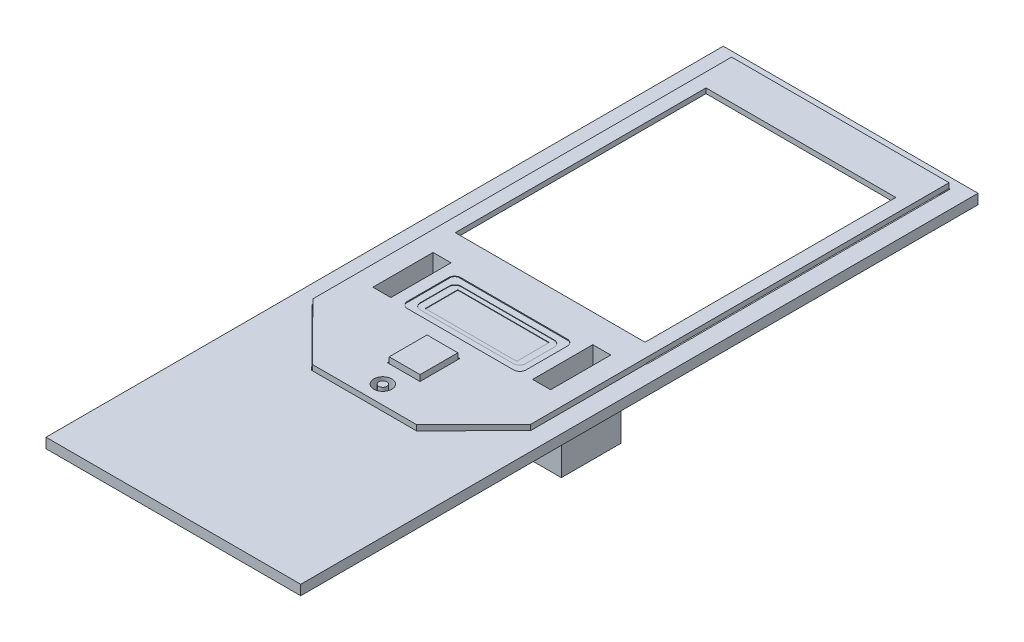
from build123d import *

# Parameters (mm, degrees)
SKETCH1_W                   = 51.332398317
SKETCH1_H                   = 136.325385694
BOSS_EXTRUDE1_DEPTH         = 2
CUT_EXTRUDE1_DEPTH          = 1
SKETCH3_W                   = 26.718092566
SKETCH3_H                   = 51.160838605
CUT_EXTRUDE2_DEPTH          = 1
SKETCH4_W                   = 20.659186536
SKETCH4_H                   = 13.604488078
BOSS_EXTRUDE2_DEPTH         = 1
SKETCH5_W                   = 6.521739131
SKETCH5_H                   = 14.853538096
SKETCH5_W_2                 = 6.52173913
SKETCH5_H_2                 = 15.644764374
CUT_EXTRUDE3_DEPTH          = 1
SKETCH6_W                   = 6.171107994
SKETCH6_H                   = 7.573632539
CUT_EXTRUDE4_DEPTH          = 1
SKETCH7_R                   = 2.489481066
CUT_EXTRUDE5_DEPTH          = 1
BOSS_EXTRUDE3_DEPTH         = 1
SKETCH10_W                  = 6.171107994
SKETCH10_H                  = 7.573632539
BOSS_EXTRUDE4_DEPTH         = 4
BOSS_EXTRUDE5_DEPTH         = 2
SKETCH12_W                  = 6.571107994
SKETCH12_H                  = 7.973632539
CUT_EXTRUDE6_DEPTH          = 2
SKETCH13_R                  = 1.8
SKETCH13_W                  = 26.718092566
SKETCH13_H                  = 51.160838605
CUT_EXTRUDE9_DEPTH          = 2
SKETCH14_R                  = 2.2
SKETCH14_R_2                = 1.8
BOSS_EXTRUDE11_DEPTH        = 2
SKETCH17_R                  = 2.2
BOSS_EXTRUDE12_DEPTH        = 1
SKETCH18_R                  = 0.8
BOSS_EXTRUDE15_DEPTH        = 3.4
EXTRUDE_THIN3_OUTLINE_W     = 5.6
EXTRUDE_THIN3_OUTLINE_H     = 14.844764374
EXTRUDE_THIN3_OUTLINE_W_2   = 3.6
EXTRUDE_THIN3_OUTLINE_H_2   = 12.844764374
EXTRUDE_THIN3_DEPTH         = 13.32398317
EXTRUDE_THIN3_2_OUTLINE_W   = 5.6
EXTRUDE_THIN3_2_OUTLINE_H   = 14.053538096
EXTRUDE_THIN3_2_OUTLINE_W_2 = 3.6
EXTRUDE_THIN3_2_OUTLINE_H_2 = 12.053538096
EXTRUDE_THIN3_2_DEPTH       = 13.32398317
SKETCH26_W                  = 3.6
SKETCH26_H                  = 12.053538096
SKETCH26_H_2                = 12.844764374
CUT_EXTRUDE12_DEPTH         = 13.32398317
SKETCH27_W                  = 5.6
SKETCH27_H                  = 14.053538096
BOSS_EXTRUDE18_DEPTH        = 1
SKETCH27_W_2                = 5.570395019
SKETCH27_H_2                = 14.844764374
BOSS_EXTRUDE18_2_DEPTH      = 1
SKETCH28_W                  = 20.659186536
SKETCH28_H                  = 13.604488078
CUT_EXTRUDE13_DEPTH         = 1
SKETCH29_W                  = 23.777559608
SKETCH29_H                  = 10.728152402
CUT_EXTRUDE15_DEPTH         = 10
SKETCH30_W                  = 23.777559608
SKETCH30_H                  = 10.728152402
SKETCH30_W_2                = 21.112762974
SKETCH30_H_2                = 8.203608222
BOSS_EXTRUDE20_DEPTH        = 1.8
SKETCH31_W                  = 21.112762974
SKETCH31_H                  = 8.203608222
BOSS_EXTRUDE21_DEPTH        = 1.6
SKETCH35_W                  = 23.977559608
SKETCH35_H                  = 10.928152402
CUT_EXTRUDE21_DEPTH         = 1.9
FILLET2_R                   = 1.25
FILLET3_R                   = 1.25
SKETCH37_W                  = 18.307713885
SKETCH37_H                  = 6.527591392
CUT_EXTRUDE22_DEPTH         = 0.1
SKETCH41_W                  = 18.307713885
SKETCH41_H                  = 6.527591392
BOSS_EXTRUDE27_DEPTH        = 0.1
SKETCH43_W                  = 18.307713885
SKETCH43_H                  = 6.527591392
BOSS_EXTRUDE28_DEPTH        = 0.1
CUT_EXTRUDE24_DEPTH         = 40.1
SKETCH51_W                  = 5.6
SKETCH51_H                  = 4.468914857
BOSS_EXTRUDE29_DEPTH        = 1
BOSS_EXTRUDE29_2_DEPTH      = 1
SKETCH52_W                  = 5.6
SKETCH52_H                  = 1
BOSS_EXTRUDE30_DEPTH        = 2.5
BOSS_EXTRUDE30_2_DEPTH      = 2.5
SKETCH53_W                  = 5.6
SKETCH53_H                  = 1
BOSS_EXTRUDE31_DEPTH        = 1
BOSS_EXTRUDE32_START        = 7.421556697
BOSS_EXTRUDE32_DEPTH        = 5.6
BOSS_EXTRUDE32_START_2      = -24.556002911
BOSS_EXTRUDE32_2_DEPTH      = 5.6
SKETCH55_W                  = 3.6
SKETCH55_H                  = 0.791226278
BOSS_EXTRUDE33_DEPTH        = 14.323983
SKETCH56_W                  = 0.791226278
SKETCH56_H                  = 13.32398317
CUT_EXTRUDE25_DEPTH         = 5.6
CUT_EXTRUDE_THIN1_DEPTH     = 1
SKETCH59_W                  = 71.33
SKETCH59_H                  = 156.33
SKETCH59_W_2                = 51.33
SKETCH59_H_2                = 136.33
CUT_EXTRUDE_THIN2_DEPTH     = 10
SKETCH60_W                  = 71
SKETCH60_H                  = 156
SKETCH60_W_2                = 51
SKETCH60_H_2                = 136
CUT_EXTRUDE_THIN3_DEPTH     = 10
SKETCH61_W                  = 51
SKETCH61_H                  = 2
CUT_EXTRUDE26_DEPTH         = 0.4
SKETCH62_W                  = 38
SKETCH62_H                  = 51.160838605
CUT_EXTRUDE28_DEPTH         = 10
SKETCH64_W                  = 38
SKETCH64_H                  = 0.08
BOSS_EXTRUDE35_DEPTH        = 2
SKETCH65_W                  = 38
SKETCH65_H                  = 0.08
BOSS_EXTRUDE37_DEPTH        = 1
SKETCH67_W                  = 44
SKETCH67_H                  = 61.400838605
CUT_EXTRUDE31_DEPTH         = 2
SKETCH69_W                  = 40.716981818
SKETCH69_H                  = 1
BOSS_EXTRUDE39_DEPTH        = 1.863286117
SKETCH70_W                  = 44
SKETCH70_H                  = 2
BOSS_EXTRUDE40_DEPTH        = 1
SKETCH71_W                  = 38
SKETCH71_H                  = 1
CUT_EXTRUDE32_DEPTH         = 1
SKETCH72_W                  = 38
SKETCH72_H                  = 1
BOSS_EXTRUDE41_DEPTH        = 1.8
SKETCH73_W                  = 44
SKETCH73_H                  = 2
CUT_EXTRUDE33_DEPTH         = 0.3
SKETCH74_W                  = 43.548387097
SKETCH74_H                  = 1
BOSS_EXTRUDE43_DEPTH        = 1.812426367
SKETCH75_R                  = 0.8
BOSS_EXTRUDE44_DEPTH        = 0.6


with BuildPart() as part:
    # Sketch1 → Boss-Extrude1 (new body)
    with BuildSketch(Plane(origin=(0, 0, 0), x_dir=(1, 0, 0), z_dir=(0, 1, 0))):
        with Locations((-5.767223106, -3.58751015)):
            Rectangle(SKETCH1_W, SKETCH1_H)
    extrude(amount=BOSS_EXTRUDE1_DEPTH)

    # Sketch2 → Cut-Extrude1 (cut)
    with BuildSketch(Plane(origin=(0, 2, 0), x_dir=(1, 0, 0), z_dir=(0, 1, 0))):
        Polygon((-27.541416655, -30.445855171), (-27.541416655, 60.542924633), (16.006970442, 60.542924633), (16.006970442, -30.445855171), (4.678976052, -41.666051524), (-16.213422265, -41.666051524), align=None)
    extrude(amount=-CUT_EXTRUDE1_DEPTH, mode=Mode.SUBTRACT)

    # Sketch3 → Cut-Extrude2 (cut)
    with BuildSketch(Plane(origin=(0, 1, 0), x_dir=(1, 0, 0), z_dir=(0, 1, 0))):
        with Locations((-5.767223107, 30.754931698)):
            Rectangle(SKETCH3_W, SKETCH3_H)
    extrude(amount=-CUT_EXTRUDE2_DEPTH, mode=Mode.SUBTRACT)

    # Sketch4 → Boss-Extrude2 (add)
    with BuildSketch(Plane(origin=(0, 1, 0), x_dir=(1, 0, 0), z_dir=(0, 1, 0))):
        with Locations((-5.767223107, -7.988180452)):
            Rectangle(SKETCH4_W, SKETCH4_H)
    extrude(amount=BOSS_EXTRUDE2_DEPTH)

    # Sketch5 → Cut-Extrude3 (cut)
    with BuildSketch(Plane(origin=(0, 1, 0), x_dir=(1, 0, 0), z_dir=(0, 1, 0))):
        with Locations((-21.756002911, -7.426769048)):
            Rectangle(SKETCH5_W, SKETCH5_H)
        with Locations((10.221556697, -7.031155909)):
            Rectangle(SKETCH5_W_2, SKETCH5_H_2)
    extrude(amount=-CUT_EXTRUDE3_DEPTH, mode=Mode.SUBTRACT)

    # Sketch6 → Cut-Extrude4 (cut)
    with BuildSketch(Plane(origin=(0, 1, 0), x_dir=(1, 0, 0), z_dir=(0, 1, 0))):
        with Locations((-5.767223107, -21.101784941)):
            Rectangle(SKETCH6_W, SKETCH6_H)
    extrude(amount=-CUT_EXTRUDE4_DEPTH, mode=Mode.SUBTRACT)

    # Sketch7 → Cut-Extrude5 (cut)
    with BuildSketch(Plane(origin=(0, 1, 0), x_dir=(1, 0, 0), z_dir=(0, 1, 0))):
        with Locations(Location((-5.767223107, -29.250452542, 0), (0, 0, 270))):
            Circle(SKETCH7_R)
    extrude(amount=-CUT_EXTRUDE5_DEPTH, mode=Mode.SUBTRACT)

    # Sketch8 → Boss-Extrude3 (add)
    with BuildSketch(Plane(origin=(0, 1, 0), x_dir=(1, 0, 0), z_dir=(0, 1, 0))):
        Polygon((-27.541416655, -21.480466567), (-27.541416655, -30.445855171), (-16.213422265, -41.666051524), (4.678976052, -41.666051524), (16.006970442, -30.445855171), (16.006970442, -21.480466567), (4.673870862, -32.903327717), (-16.208317076, -32.903327717), align=None)
    extrude(amount=BOSS_EXTRUDE3_DEPTH)

    # Sketch10 → Boss-Extrude4 (add)
    with BuildSketch(Plane.XZ):
        with Locations((-5.767223107, 21.101784941)):
            Rectangle(SKETCH10_W, SKETCH10_H)
    extrude(amount=-BOSS_EXTRUDE4_DEPTH)

    # Sketch28 → Cut-Extrude13 (cut)
    with BuildSketch(Plane(origin=(0, 2, 0), x_dir=(1, 0, 0), z_dir=(0, 1, 0))):
        with Locations((-5.767223107, -7.988180452)):
            Rectangle(SKETCH28_W, SKETCH28_H)
    extrude(amount=-CUT_EXTRUDE13_DEPTH, mode=Mode.SUBTRACT)


with BuildPart() as body_2:
    # Sketch11 → Boss-Extrude5 (new body)
    with BuildSketch(Plane(origin=(0, 1, 0), x_dir=(1, 0, 0), z_dir=(0, 1, 0))):
        Polygon((-27.541416655, 60.542924633), (16.006970442, 60.542924633), (16.006970442, -21.480466567), (4.673870862, -32.903327717), (-16.208317076, -32.903327717), (-27.541416655, -21.480466567), align=None)
    extrude(amount=BOSS_EXTRUDE5_DEPTH)

    # Sketch12 → Cut-Extrude6 (cut)
    with BuildSketch(Plane(origin=(0, 3, 0), x_dir=(1, 0, 0), z_dir=(0, 1, 0))):
        with Locations((-5.767223107, -21.10178494)):
            Rectangle(SKETCH12_W, SKETCH12_H)
    extrude(amount=-CUT_EXTRUDE6_DEPTH, mode=Mode.SUBTRACT)

    # Sketch13 → Cut-Extrude9 (cut)
    with BuildSketch(Plane.XZ.offset(-1)):
        with Locations(Location((-5.767223107, 29.250452542, 0), (0, 0, 270))):
            Circle(SKETCH13_R)
        with Locations((-5.767223107, -30.754931698)):
            Rectangle(SKETCH13_W, SKETCH13_H)
    extrude(amount=-CUT_EXTRUDE9_DEPTH, mode=Mode.SUBTRACT)


with BuildPart() as body_3:
    # Sketch14 → Boss-Extrude11 (new body)
    with BuildSketch(Plane.XZ.offset(-1)):
        with Locations(Location((-5.767223107, 29.250452542, 0), (0, 0, 270))):
            Circle(SKETCH14_R)
        with Locations(Location((-5.767223107, 29.250452542, 0), (0, 0, 270))):
            Circle(SKETCH14_R_2, mode=Mode.SUBTRACT)
    extrude(amount=BOSS_EXTRUDE11_DEPTH)

    # Combine1: union body 2
    add(body_2.part)

    # Sketch17 → Boss-Extrude12 (add)
    with BuildSketch(Plane.XZ.offset(1)):
        with Locations(Location((-5.767223107, 29.250452542, 0), (0, 0, 270))):
            Circle(SKETCH17_R)
    extrude(amount=BOSS_EXTRUDE12_DEPTH)


with BuildPart() as body_3_2:
    # Sketch18 → Boss-Extrude15 (new body)
    with BuildSketch(Plane(origin=(0, -1, 0), x_dir=(1, 0, 0), z_dir=(0, 1, 0))):
        with Locations(Location((-5.767223107, -29.250452542, 0), (0, 0, 270))):
            Circle(SKETCH18_R)
    extrude(amount=BOSS_EXTRUDE15_DEPTH)


with BuildPart() as body_3_1:
    add(body_3.part)

    # Combine3: union body 3 2
    add(body_3_2.part)

    # Sketch26 → Cut-Extrude12 (cut)
    with BuildSketch(Plane.XZ.offset(-1)):
        with Locations((-21.756002911, 7.426769048)):
            Rectangle(SKETCH26_W, SKETCH26_H)
        with Locations((10.221556697, 7.031155909)):
            Rectangle(SKETCH26_W, SKETCH26_H_2)
    extrude(amount=-CUT_EXTRUDE12_DEPTH, mode=Mode.SUBTRACT)


with BuildPart() as body_3_3:
    # Extrude-Thin3: read off the stored shape, not the designer's step
    # Extrude-Thin3 outline → Extrude-Thin3 (new body)
    with BuildSketch(Plane.XZ.offset(-1)):
        with Locations((10.221556697, 7.031155909)):
            Rectangle(EXTRUDE_THIN3_OUTLINE_W, EXTRUDE_THIN3_OUTLINE_H)
        with Locations((10.221556697, 7.031155909)):
            Rectangle(EXTRUDE_THIN3_OUTLINE_W_2, EXTRUDE_THIN3_OUTLINE_H_2, mode=Mode.SUBTRACT)
    extrude(amount=EXTRUDE_THIN3_DEPTH)


with BuildPart() as body_4:
    # Extrude-Thin3 2 outline → Extrude-Thin3 2 (new body)
    with BuildSketch(Plane.XZ.offset(-1)):
        with Locations((-21.756002911, 7.426769048)):
            Rectangle(EXTRUDE_THIN3_2_OUTLINE_W, EXTRUDE_THIN3_2_OUTLINE_H)
        with Locations((-21.756002911, 7.426769048)):
            Rectangle(EXTRUDE_THIN3_2_OUTLINE_W_2, EXTRUDE_THIN3_2_OUTLINE_H_2, mode=Mode.SUBTRACT)
    extrude(amount=EXTRUDE_THIN3_2_DEPTH)


with BuildPart() as body_5:
    # Sketch27 → Boss-Extrude18 (new body)
    with BuildSketch(Plane.XZ.offset(12.32398317)):
        with Locations((-21.756002911, 7.426769048)):
            Rectangle(SKETCH27_W, SKETCH27_H)
    extrude(amount=-BOSS_EXTRUDE18_DEPTH)


with BuildPart() as body_6:
    # Sketch27 → Boss-Extrude18 2 (new body)
    with BuildSketch(Plane.XZ.offset(12.32398317)):
        with Locations((10.206754207, 7.031155909)):
            Rectangle(SKETCH27_W_2, SKETCH27_H_2)
    extrude(amount=-BOSS_EXTRUDE18_2_DEPTH)


with BuildPart() as body_4_1:
    add(body_4.part)

    # Combine4: union body 3 3, body 3, body 5, body 6
    add(body_3_3.part)
    add(body_3_1.part)
    add(body_5.part)
    add(body_6.part)

    # Sketch29 → Cut-Extrude15 (cut)
    with BuildSketch(Plane(origin=(0, 3, 0), x_dir=(1, 0, 0), z_dir=(0, 1, 0))):
        with Locations((-5.767223107, -8.341916313)):
            Rectangle(SKETCH29_W, SKETCH29_H)
    extrude(amount=-CUT_EXTRUDE15_DEPTH, mode=Mode.SUBTRACT)

    # Sketch35 → Cut-Extrude21 (cut)
    with BuildSketch(Plane.XZ.offset(-1)):
        with Locations((-5.767223107, 8.341916313)):
            Rectangle(SKETCH35_W, SKETCH35_H)
    extrude(amount=-CUT_EXTRUDE21_DEPTH, mode=Mode.SUBTRACT)

    # Fillet2
    fillet2_edges = [body_4_1.edges().sort_by_distance(p)[0] for p in [
        (-17.656002911, 2.95, 13.705992514),
        (6.121556697, 2.95, 13.705992514),
        (6.121556697, 2.95, 2.977840112),
        (-17.656002911, 2.95, 2.977840112),
    ]]
    fillet(fillet2_edges, radius=FILLET2_R)

    # Sketch50 → Cut-Extrude24 (cut)
    with BuildSketch(Plane(origin=(13.021556697, 0, 0), x_dir=(0, 0, -1), z_dir=(1, 0, 0))):
        Polygon((-14.453538096, 1), (-11.293538096, -2.16), (-11.293538096, -12.32398317), (-14.453538096, -12.32398317), align=None)
    extrude(amount=-CUT_EXTRUDE24_DEPTH, mode=Mode.SUBTRACT)


with BuildPart() as body_3_4:
    # Sketch30 → Boss-Extrude20 (new body)
    with BuildSketch(Plane(origin=(0, 1, 0), x_dir=(1, 0, 0), z_dir=(0, 1, 0))):
        with Locations((-5.767223107, -8.341916313)):
            Rectangle(SKETCH30_W, SKETCH30_H)
        with Locations((-5.767223107, -8.341916313)):
            Rectangle(SKETCH30_W_2, SKETCH30_H_2, mode=Mode.SUBTRACT)
    extrude(amount=BOSS_EXTRUDE20_DEPTH)


with BuildPart() as body_4_2:
    # Sketch31 → Boss-Extrude21 (new body)
    with BuildSketch(Plane(origin=(0, 1, 0), x_dir=(1, 0, 0), z_dir=(0, 1, 0))):
        with Locations((-5.767223107, -8.341916313)):
            Rectangle(SKETCH31_W, SKETCH31_H)
    extrude(amount=BOSS_EXTRUDE21_DEPTH)


with BuildPart() as part_1:
    add(part.part)

    # Combine5: union body 3 4, body 4 2
    add(body_3_4.part)
    add(body_4_2.part)

    # Fillet3
    fillet3_edges = [part_1.edges().sort_by_distance(p)[0] for p in [
        (-16.323604594, 2.7, 12.443720424),
        (4.78915838, 2.7, 12.443720424),
        (4.78915838, 2.7, 4.240112202),
        (-16.323604594, 2.7, 4.240112202),
    ]]
    fillet(fillet3_edges, radius=FILLET3_R)

    # Sketch37 → Cut-Extrude22 (cut)
    with BuildSketch(Plane(origin=(0, 2.6, 0), x_dir=(1, 0, 0), z_dir=(0, 1, 0))):
        with Locations((-5.767223107, -8.341916313)):
            Rectangle(SKETCH37_W, SKETCH37_H)
    extrude(amount=-CUT_EXTRUDE22_DEPTH, mode=Mode.SUBTRACT)


with BuildPart() as body_3_5:
    # Sketch41 → Boss-Extrude27 (new body)
    with BuildSketch(Plane(origin=(0, 2.6, 0), x_dir=(1, 0, 0), z_dir=(0, 1, 0))):
        with BuildLine():
            Line((-15.073604594, -12.443720424), (3.53915838, -12.443720424))
            ThreePointArc((3.53915838, -12.443720424), (4.423041856, -12.077603901), (4.78915838, -11.193720424))
            Line((4.78915838, -11.193720424), (4.78915838, -5.490112202))
            ThreePointArc((4.78915838, -5.490112202), (4.423041856, -4.606228725), (3.53915838, -4.240112202))
            Line((3.53915838, -4.240112202), (-15.073604594, -4.240112202))
            ThreePointArc((-15.073604594, -4.240112202), (-15.95748807, -4.606228725), (-16.323604594, -5.490112202))
            Line((-16.323604594, -5.490112202), (-16.323604594, -11.193720424))
            ThreePointArc((-16.323604594, -11.193720424), (-15.95748807, -12.077603901), (-15.073604594, -12.443720424))
        make_face()
        with Locations((-5.767223107, -8.341916313)):
            Rectangle(SKETCH41_W, SKETCH41_H, mode=Mode.SUBTRACT)
    extrude(amount=BOSS_EXTRUDE27_DEPTH)

    # Combine6: union part
    add(part_1.part)


with BuildPart() as body_3_6:
    # Sketch43 → Boss-Extrude28 (new body)
    with BuildSketch(Plane(origin=(0, 2.5, 0), x_dir=(1, 0, 0), z_dir=(0, 1, 0))):
        with Locations((-5.767223107, -8.341916313)):
            Rectangle(SKETCH43_W, SKETCH43_H)
    extrude(amount=BOSS_EXTRUDE28_DEPTH)

    # Combine7: union body 3 5
    add(body_3_5.part)

    # Sketch58 → Cut-Extrude-Thin1 (cut)
    with BuildSketch(Plane(origin=(0, 1, 0), x_dir=(1, 0, 0), z_dir=(0, 1, 0))):
        Polygon((-16.249969686, -33.003327717), (4.715523472, -33.003327717), (16.106970442, -21.521657048), (16.106970442, 60.642924633), (-27.641416655, 60.642924633), (-27.641416655, -21.521657048), align=None)
        Polygon((-16.208317076, -32.903327717), (4.673870862, -32.903327717), (16.006970442, -21.480466567), (16.006970442, 60.542924633), (-27.541416655, 60.542924633), (-27.541416655, -21.480466567), align=None, mode=Mode.SUBTRACT)
    extrude(amount=CUT_EXTRUDE_THIN1_DEPTH, mode=Mode.SUBTRACT)

    # Sketch59 → Cut-Extrude-Thin2 (cut)
    with BuildSketch(Plane(origin=(0, 2, 0), x_dir=(1, 0, 0), z_dir=(0, 1, 0))):
        with Locations((-5.767223107, -3.58751015)):
            Rectangle(SKETCH59_W, SKETCH59_H)
        with Locations((-5.767223107, -3.58751015)):
            Rectangle(SKETCH59_W_2, SKETCH59_H_2, mode=Mode.SUBTRACT)
    extrude(amount=-CUT_EXTRUDE_THIN2_DEPTH, mode=Mode.SUBTRACT)

    # Sketch60 → Cut-Extrude-Thin3 (cut)
    with BuildSketch(Plane(origin=(0, 2, 0), x_dir=(1, 0, 0), z_dir=(0, 1, 0))):
        with Locations((-5.767223107, -3.58751015)):
            Rectangle(SKETCH60_W, SKETCH60_H)
        with Locations((-5.767223107, -3.58751015)):
            Rectangle(SKETCH60_W_2, SKETCH60_H_2, mode=Mode.SUBTRACT)
    extrude(amount=-CUT_EXTRUDE_THIN3_DEPTH, mode=Mode.SUBTRACT)

    # Sketch61 → Cut-Extrude26 (cut)
    with BuildSketch(Plane.XY.offset(71.58751015)):
        with Locations((-5.767223107, 1)):
            Rectangle(SKETCH61_W, SKETCH61_H)
    extrude(amount=-CUT_EXTRUDE26_DEPTH, mode=Mode.SUBTRACT)


with BuildPart() as body_3_7:
    # Sketch51 → Boss-Extrude29 (new body)
    with BuildSketch(Plane(origin=(0, -6.726769048, 6.726769048), x_dir=(1, 0, 0), z_dir=(0, -0.7071067811865475, 0.7071067811865476))):
        with Locations((10.221556697, 8.692844153)):
            Rectangle(SKETCH51_W, SKETCH51_H)
    extrude(amount=BOSS_EXTRUDE29_DEPTH)


with BuildPart() as body_4_3:
    # Sketch51 → Boss-Extrude29 2 (new body)
    with BuildSketch(Plane(origin=(0, -6.726769048, 6.726769048), x_dir=(1, 0, 0), z_dir=(0, -0.7071067811865475, 0.7071067811865476))):
        with Locations((-21.756002911, 8.692844153)):
            Rectangle(SKETCH51_W, SKETCH51_H)
    extrude(amount=BOSS_EXTRUDE29_2_DEPTH)


with BuildPart() as body_5_2:
    # Sketch52 → Boss-Extrude30 (new body)
    with BuildSketch(Plane(origin=(0, 7.726769048, 7.726769048), x_dir=(1, 0, 0), z_dir=(0, 0.7071067811865476, 0.7071067811865475))):
        with Locations((10.221556697, -10.013088019)):
            Rectangle(SKETCH52_W, SKETCH52_H)
    extrude(amount=BOSS_EXTRUDE30_DEPTH)


with BuildPart() as body_6_2:
    # Sketch52 → Boss-Extrude30 2 (new body)
    with BuildSketch(Plane(origin=(0, 7.726769048, 7.726769048), x_dir=(1, 0, 0), z_dir=(0, 0.7071067811865476, 0.7071067811865475))):
        with Locations((-21.756002911, -10.013088019)):
            Rectangle(SKETCH52_W, SKETCH52_H)
    extrude(amount=BOSS_EXTRUDE30_2_DEPTH)


with BuildPart() as body_4_4:
    add(body_4_1.part)

    # Combine8: union body 3 7, body 4 3, body 5 2, body 6 2
    add(body_3_7.part)
    add(body_4_3.part)
    add(body_5_2.part)
    add(body_6_2.part)

    # Sketch53 → Boss-Extrude31 (add)
    with BuildSketch(Plane.XY.offset(11.293538096)):
        with Locations((-21.756002911, -11.82398317)):
            Rectangle(SKETCH53_W, SKETCH53_H)
        with Locations((10.221556697, -11.82398317)):
            Rectangle(SKETCH53_W, SKETCH53_H)
    extrude(amount=BOSS_EXTRUDE31_DEPTH)


with BuildPart() as body_3_8:
    # Boss-Extrude32: read off the stored shape, not the designer's step
    # Boss-Extrude32 outline → Boss-Extrude32 (new body)
    with BuildSketch(Plane.YZ.offset(BOSS_EXTRUDE32_START)):
        Polygon((-11.32398317, 11.293538096), (-2.16, 11.293538096), (-2.867106781, 12.000644877), (-2.574213562, 12.293538096), (-11.32398317, 12.293538096), align=None)
    extrude(amount=BOSS_EXTRUDE32_DEPTH)


with BuildPart() as body_4_4_1:
    # Boss-Extrude32 2 outline → Boss-Extrude32 2 (new body)
    with BuildSketch(Plane.YZ.offset(BOSS_EXTRUDE32_START_2)):
        Polygon((-11.32398317, 11.293538096), (-2.16, 11.293538096), (-2.867106781, 12.000644877), (-2.574213562, 12.293538096), (-11.32398317, 12.293538096), align=None)
    extrude(amount=BOSS_EXTRUDE32_2_DEPTH)


with BuildPart() as body_4_5:
    add(body_4_4.part)

    # Combine9: union body 4 4, body 3 8
    add(body_4_4_1.part)
    add(body_3_8.part)

    # Sketch55 → Boss-Extrude33 (add)
    with BuildSketch(Plane(origin=(0, -11.32398317, 0), x_dir=(1, 0, 0), z_dir=(0, 1, 0))):
        with Locations((10.221556697, -1.004386861)):
            Rectangle(SKETCH55_W, SKETCH55_H)
    extrude(amount=BOSS_EXTRUDE33_DEPTH)

    # Sketch56 → Cut-Extrude25 (cut)
    with BuildSketch(Plane.ZY.offset(-7.421556697)):
        with Locations((0.004386861, -5.661991585)):
            Rectangle(SKETCH56_W, SKETCH56_H)
    extrude(amount=-CUT_EXTRUDE25_DEPTH, mode=Mode.SUBTRACT)


with BuildPart() as cut_extrude28_tool:
    # Sketch62 → Cut-Extrude28 (new body)
    with BuildSketch(Plane(origin=(0, 3, 0), x_dir=(1, 0, 0), z_dir=(0, 1, 0))):
        with Locations((-5.767223107, 30.754931698)):
            Rectangle(SKETCH62_W, SKETCH62_H)
    extrude(amount=-CUT_EXTRUDE28_DEPTH)


with BuildPart() as body_4_6:
    add(body_4_5.part)

    # Cut-Extrude28: cut by cut_extrude28_tool
    add(cut_extrude28_tool.part, mode=Mode.SUBTRACT)

    # Sketch64 → Boss-Extrude35 (add)
    with BuildSketch(Plane(origin=(0, 3, 0), x_dir=(1, 0, 0), z_dir=(0, 1, 0))):
        with Locations((-5.767223107, 5.214512395)):
            Rectangle(SKETCH64_W, SKETCH64_H)
        with Locations((-5.767223107, 56.295351)):
            Rectangle(SKETCH64_W, SKETCH64_H)
    extrude(amount=-BOSS_EXTRUDE35_DEPTH)


with BuildPart() as body_3_6_1:
    add(body_3_6.part)

    # Cut-Extrude28: cut by cut_extrude28_tool
    add(cut_extrude28_tool.part, mode=Mode.SUBTRACT)

    # Sketch65 → Boss-Extrude37 (add)
    with BuildSketch(Plane.XZ):
        with Locations((-5.767223107, -5.214512395)):
            Rectangle(SKETCH65_W, SKETCH65_H)
        with Locations((-5.767223107, -56.295351)):
            Rectangle(SKETCH65_W, SKETCH65_H)
    extrude(amount=-BOSS_EXTRUDE37_DEPTH)


with BuildPart() as cut_extrude31_tool:
    # Sketch67 → Cut-Extrude31 (new body)
    with BuildSketch(Plane.XZ):
        with Locations((-5.767223107, -32.354931697)):
            Rectangle(SKETCH67_W, SKETCH67_H)
    extrude(amount=-CUT_EXTRUDE31_DEPTH)


with BuildPart() as body_4_7:
    add(body_4_6.part)

    # Cut-Extrude31: cut by cut_extrude31_tool
    add(cut_extrude31_tool.part, mode=Mode.SUBTRACT)

    # Sketch71 → Cut-Extrude32 (cut)
    with BuildSketch(Plane(origin=(0, 0, -5.254512395), x_dir=(-1, 0, 0), z_dir=(0, 0, -1))):
        with Locations((5.767223107, 2.5)):
            Rectangle(SKETCH71_W, SKETCH71_H)
    extrude(amount=-CUT_EXTRUDE32_DEPTH, mode=Mode.SUBTRACT)

    # Sketch72 → Boss-Extrude41 (add)
    with BuildSketch(Plane.XY.offset(-56.255351)):
        with Locations((-5.767223107, 2.5)):
            Rectangle(SKETCH72_W, SKETCH72_H)
    extrude(amount=BOSS_EXTRUDE41_DEPTH)

    # Sketch74 → Boss-Extrude43 (add)
    with BuildSketch(Plane(origin=(0, 0, -60.542924633), x_dir=(-1, 0, 0), z_dir=(0, 0, -1))):
        with Locations((5.767223107, 2.5)):
            Rectangle(SKETCH74_W, SKETCH74_H)
    extrude(amount=BOSS_EXTRUDE43_DEPTH)

    # Sketch75 → Boss-Extrude44 (add)
    with BuildSketch(Plane(origin=(0, 3, 0), x_dir=(1, 0, 0), z_dir=(0, 1, 0))):
        with Locations(Location((-5.767223107, -29.250452542, 0), (0, 0, 90))):
            Circle(SKETCH75_R)
    extrude(amount=-BOSS_EXTRUDE44_DEPTH)


with BuildPart() as body_3_6_2:
    add(body_3_6_1.part)

    # Cut-Extrude31: cut by cut_extrude31_tool
    add(cut_extrude31_tool.part, mode=Mode.SUBTRACT)

    # Sketch69 → Boss-Extrude39 (add)
    with BuildSketch(Plane(origin=(0, 0, -1.654512395), x_dir=(-1, 0, 0), z_dir=(0, 0, -1))):
        with Locations((6.105401472, 0.5)):
            Rectangle(SKETCH69_W, SKETCH69_H)
    extrude(amount=-BOSS_EXTRUDE39_DEPTH)

    # Sketch70 → Boss-Extrude40 (add)
    with BuildSketch(Plane.XY.offset(-63.055351)):
        with Locations((-5.767223107, 1)):
            Rectangle(SKETCH70_W, SKETCH70_H)
    extrude(amount=BOSS_EXTRUDE40_DEPTH)

    # Sketch73 → Cut-Extrude33 (cut)
    with BuildSketch(Plane.XY.offset(-62.055351)):
        with Locations((-5.767223107, 1)):
            Rectangle(SKETCH73_W, SKETCH73_H)
    extrude(amount=-CUT_EXTRUDE33_DEPTH, mode=Mode.SUBTRACT)


solid = Compound([body_4_7.part, body_3_6_2.part])
